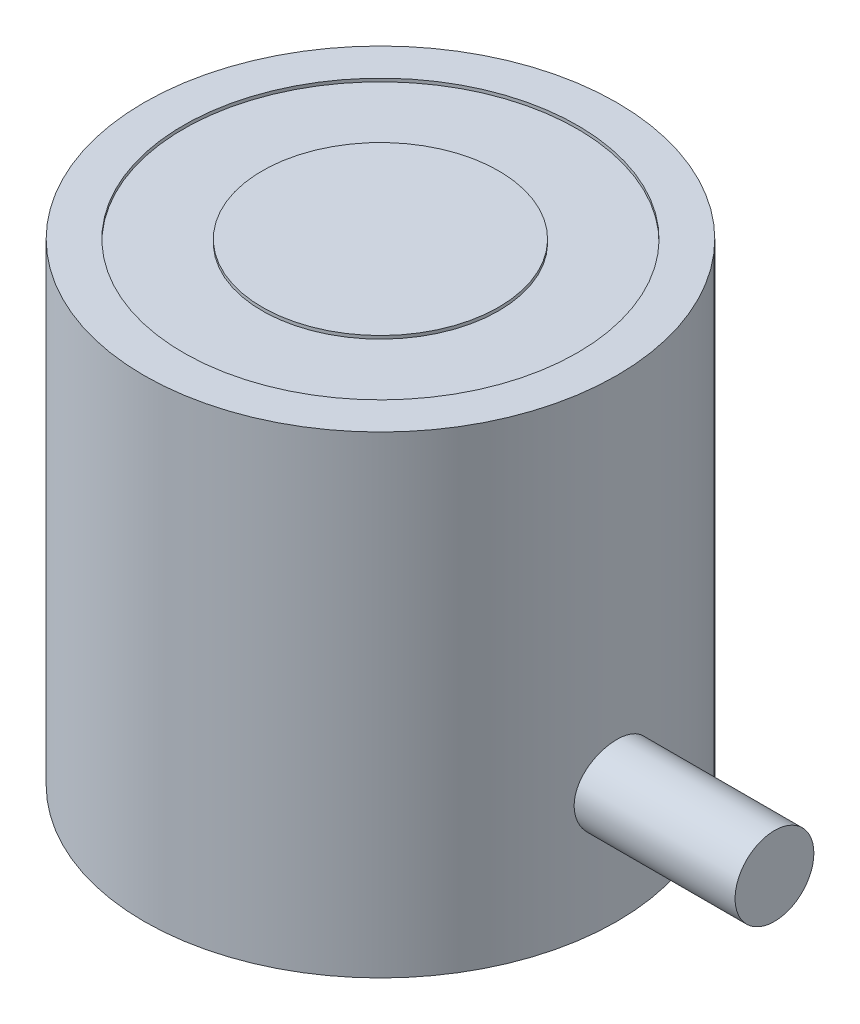
from build123d import *

# Parameters (mm, degrees)
SKETCH1_R                    = 19.05
BOSS_EXTRUDE1_DEPTH          = 38.1
SKETCH2_W                    = 6.35
SKETCH2_H                    = 0.254
SKETCH3_R                    = 3.175
CUT_EXTRUDE1_DEPTH           = 12.7
SWEEP1_PITCH                 = 1.27
SKETCH6_R                    = 3.312481533
CUT_EXTRUDE2_OTHER_WAY_DEPTH = 47.662779682
BOSS_EXTRUDE2_START          = 31.75
SKETCH7_R                    = 3.175
BOSS_EXTRUDE2_DEPTH          = 12.966446689


with BuildPart() as part:
    # Sketch1 → Boss-Extrude1 (new body)
    with BuildSketch(Plane(origin=(0, 0, 0), x_dir=(1, 0, 0), z_dir=(0, 1, 0))):
        with Locations(Location((0, 0, 0), (0, 0, 90))):
            Circle(SKETCH1_R)
    extrude(amount=BOSS_EXTRUDE1_DEPTH)

    # Sketch2 → Cut-Revolve1 (revolve, cut)
    with BuildSketch(Plane.XY, mode=Mode.PRIVATE) as cut_revolve1_sk:
        with Locations((-12.7, 37.973)):
            Rectangle(SKETCH2_W, SKETCH2_H)
    revolve(cut_revolve1_sk.sketch.rotate(Axis((0, 0, 0), (0, 1, 0)), 180), axis=Axis((0, 0, 0), (0, 1, 0)), mode=Mode.SUBTRACT)

    # Sketch3 → Cut-Extrude1 (cut)
    with BuildSketch(Plane.XZ):
        with Locations(Location((0, 0, 0), (0, 0, 270))):
            Circle(SKETCH3_R)
    extrude(amount=-CUT_EXTRUDE1_DEPTH, mode=Mode.SUBTRACT)

    # Sweep1: the profile of Sketch5 screwed along a right-hand helix of 11 turns, 8 arcs to a turn; built about Z, then put on its axis
    sweep1_z = Axis((0, 0, 0), (0, 0, 1))
    sweep1_corners = [(3.243740766, 0, -1.1509375), (3.243740766, 0, 0.0396875), (2.487592336, 0, -0.396875), (2.487592336, 0, -0.714375)]
    with BuildLine(mode=Mode.PRIVATE) as sweep1_profile:
        Line(sweep1_corners[0], sweep1_corners[1])
        Line(sweep1_corners[1], sweep1_corners[2])
        Line(sweep1_corners[2], sweep1_corners[3])
        Line(sweep1_corners[3], sweep1_corners[0])
    sweep1_cap = Face(sweep1_profile.wire())
    sweep1_turn_angles = [0, 22.5, 45, 67.5, 90, 112.5, 135, 157.5, 180, 202.5, 225, 247.5, 270, 292.5, 315, 337.5, 360]
    sweep1_turn_weights = [1, 0.9238795325112867, 1, 0.9238795325112867, 1, 0.9238795325112867, 1, 0.9238795325112867, 1, 0.9238795325112867, 1, 0.9238795325112867, 1, 0.9238795325112867, 1, 0.9238795325112867, 1]
    sweep1_turn_rails = [Edge.make_bspline([Vector(p[0], p[1], 0).rotate(sweep1_z, sweep1_turn_angles[k]) / sweep1_turn_weights[k] + Vector(0, 0, p[2] + SWEEP1_PITCH * sweep1_turn_angles[k] / 360) for k in range(17)], [0, 0, 0, 1, 1, 2, 2, 3, 3, 4, 4, 5, 5, 6, 6, 7, 7, 8, 8, 8], 2, sweep1_turn_weights) for p in sweep1_corners]
    sweep1_turn_sides = [Face.make_surface_from_curves(sweep1_turn_rails[p[0]], sweep1_turn_rails[p[1]]) for p in [(0, 1), (1, 2), (2, 3), (3, 0)]]
    sweep1 = Plane(origin=(0, 0, 0), x_dir=(-1, 0, 0), z_dir=(0, 1, 0)) * Solid(Shell([*[p.moved(Location((0, 0, SWEEP1_PITCH * i))) for i in range(11) for p in sweep1_turn_sides], sweep1_cap, sweep1_cap.rotate(sweep1_z, 3960).moved(Location((0, 0, SWEEP1_PITCH * 3960 / 360)))]))
    add(sweep1)

    # Cut-Extrude2 cone 1 section (through the dimple's axis) → Cut-Extrude2 (revolve, cut)
    with BuildSketch(Plane(origin=(0, 0, 0), x_dir=(0, 0, -1), z_dir=(1, 0, 0))):
        Polygon((0, 0), (3.312481533, 0), (0, 3.312481533), align=None)
    revolve(axis=Axis((0, 0, 0), (0, 1, 0)), mode=Mode.SUBTRACT)

    # Sketch6 → Cut-Extrude2 other way (cut)
    with BuildSketch(Plane.XZ):
        Circle(SKETCH6_R)
    extrude(amount=CUT_EXTRUDE2_OTHER_WAY_DEPTH, mode=Mode.SUBTRACT)

    # Sketch7 → Boss-Extrude2 (add)
    with BuildSketch(Plane(origin=(0, 0, 0), x_dir=(0, 0, -1), z_dir=(1, 0, 0)).offset(BOSS_EXTRUDE2_START)):
        with Locations((0, 9.525)):
            Circle(SKETCH7_R)
    extrude(amount=-BOSS_EXTRUDE2_DEPTH)


solid = part.part
